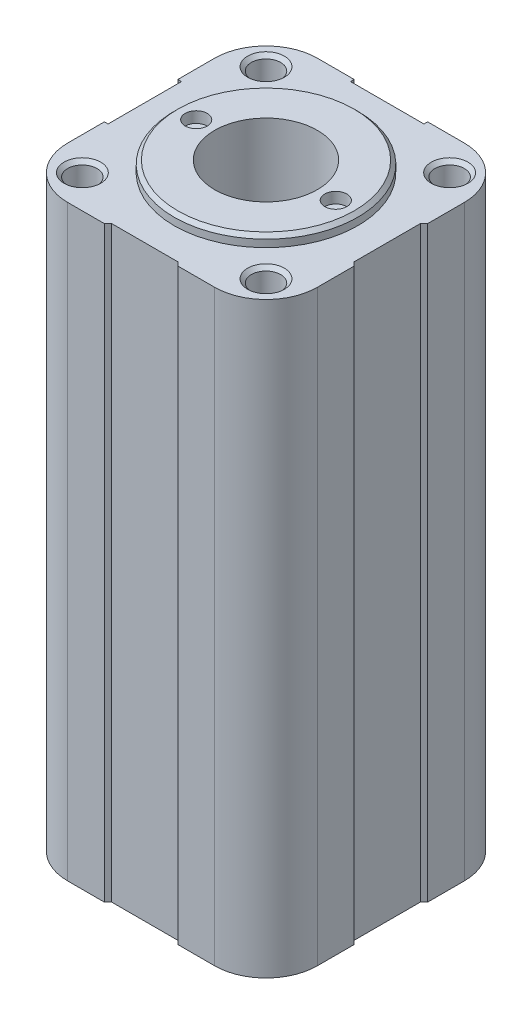
from build123d import *

# Parameters (mm, degrees)
SKETCH_1_W           = 34
SKETCH_1_H           = 34
EXTRUDE_1_DEPTH      = 80
FILLET_1_R           = 7
CUT_EXTRUDE_8_REACH  = 85.534
SKETCH_13_W          = 10
SKETCH_13_H          = 0.5
SKETCH_13_W_2        = 0.5
SKETCH_13_H_2        = 10
CHAMFER_1_SIZE       = 0.5
SKETCH_18_R          = 2
CUT_EXTRUDE_9_DEPTH  = 7.2
CHAMFER_2_SIZE       = 0.5
CUT_EXTRUDE_START    = -7.2
SKETCH_19_R          = 2
CUT_EXTRUDE_10_DEPTH = 7.2
CHAMFER_3_SIZE       = 0.5
SKETCH_20_R          = 12.5
EXTRUDE_2_DEPTH      = 1.5
CHAMFER_4_SIZE       = 0.5
SKETCH_21_R          = 7
SKETCH_21_R_2        = 1.5
CUT_EXTRUDE_11_DEPTH = 1.5
SKETCH_23_R          = 7
CUT_EXTRUDE_12_DEPTH = 13.5
CUT_EXTRUDE_START_2  = -80
SKETCH_10_W          = 10
SKETCH_10_H          = 0.5
CUT_EXTRUDE_4_DEPTH  = 80
SKETCH_12_W          = 0.5
SKETCH_12_H          = 10
CUT_EXTRUDE_5_DEPTH  = 80


with BuildPart() as part:
    # ｽｹｯﾁ1 → ﾎﾞｽ - 押し出し1 (new body)
    with BuildSketch(Plane(origin=(0, 0, 0), x_dir=(1, 0, 0), z_dir=(0, 1, 0))):
        Rectangle(SKETCH_1_W, SKETCH_1_H)
    extrude(amount=EXTRUDE_1_DEPTH)

    # ﾌｨﾚｯﾄ1
    fillet_1_edges = [part.edges().sort_by_distance(p)[0] for p in [
        (-17, 40, -17),
        (17, 40, -17),
        (17, 40, 17),
        (-17, 40, 17),
    ]]
    fillet(fillet_1_edges, radius=FILLET_1_R)

    # ｽｹｯﾁ13 → ｶｯﾄ - 押し出し8 (cut, up to next)
    with BuildSketch(Plane.XZ, mode=Mode.PRIVATE) as cut_extrude_8_sk1:
        with Locations((0, 16.75)):
            Rectangle(SKETCH_13_W, SKETCH_13_H)
    cut_extrude_8_tool1 = extrude(cut_extrude_8_sk1.sketch, amount=-CUT_EXTRUDE_8_REACH, mode=Mode.PRIVATE) & part.part
    # ｽｹｯﾁ13 → ｶｯﾄ - 押し出し8 (cut, up to next)
    with BuildSketch(Plane.XZ, mode=Mode.PRIVATE) as cut_extrude_8_sk2:
        with Locations((-16.75, 0)):
            Rectangle(SKETCH_13_W_2, SKETCH_13_H_2)
    cut_extrude_8_tool2 = extrude(cut_extrude_8_sk2.sketch, amount=-CUT_EXTRUDE_8_REACH, mode=Mode.PRIVATE) & part.part
    # ｽｹｯﾁ13 → ｶｯﾄ - 押し出し8 (cut, up to next)
    with BuildSketch(Plane.XZ, mode=Mode.PRIVATE) as cut_extrude_8_sk3:
        with Locations((0, -16.75)):
            Rectangle(SKETCH_13_W, SKETCH_13_H)
    cut_extrude_8_tool3 = extrude(cut_extrude_8_sk3.sketch, amount=-CUT_EXTRUDE_8_REACH, mode=Mode.PRIVATE) & part.part
    # ｽｹｯﾁ13 → ｶｯﾄ - 押し出し8 (cut, up to next)
    with BuildSketch(Plane.XZ, mode=Mode.PRIVATE) as cut_extrude_8_sk4:
        with Locations((16.75, 0)):
            Rectangle(SKETCH_13_W_2, SKETCH_13_H_2)
    cut_extrude_8_tool4 = extrude(cut_extrude_8_sk4.sketch, amount=-CUT_EXTRUDE_8_REACH, mode=Mode.PRIVATE) & part.part
    add(cut_extrude_8_tool1.solids().sort_by_distance((0, 0, 16.75))[0], mode=Mode.SUBTRACT)
    add(cut_extrude_8_tool2.solids().sort_by_distance((-16.75, 0, 0))[0], mode=Mode.SUBTRACT)
    add(cut_extrude_8_tool3.solids().sort_by_distance((0, 0, -16.75))[0], mode=Mode.SUBTRACT)
    add(cut_extrude_8_tool4.solids().sort_by_distance((16.75, 0, 0))[0], mode=Mode.SUBTRACT)

    # 面取り1
    chamfer_1_edges = [part.edges().sort_by_distance(p)[0] for p in [
        (-5, 40, 16.5),
        (5, 40, 16.5),
        (16.5, 40, 5),
        (16.5, 40, -5),
        (5, 40, -16.5),
        (-5, 40, -16.5),
        (-16.5, 40, -5),
        (-16.5, 40, 5),
    ]]
    chamfer(chamfer_1_edges, length=CHAMFER_1_SIZE - 0.0001)  # a hair under: the kernel refuses the full size

    # ｽｹｯﾁ18 → ｶｯﾄ - 押し出し9 (cut)
    with BuildSketch(Plane.XZ):
        with Locations(Location((12.5, -12.5, 0), (0, 0, 270))):
            Circle(SKETCH_18_R)
        with Locations(Location((-12.5, 12.5, 0), (0, 0, 270))):
            Circle(SKETCH_18_R)
    extrude(amount=-CUT_EXTRUDE_9_DEPTH, mode=Mode.SUBTRACT)

    # 面取り2
    chamfer_2_edges = [part.edges().sort_by_distance(p)[0] for p in [
        (12.5, 0, -10.5),
        (-12.5, 0, 14.5),
    ]]
    chamfer(chamfer_2_edges, length=CHAMFER_2_SIZE)

    # ｽｹｯﾁ19 → ｶｯﾄ - 押し出し10 (cut)
    with BuildSketch(Plane(origin=(0, 80, 0), x_dir=(1, 0, 0), z_dir=(0, 1, 0)).offset(CUT_EXTRUDE_START)):
        with Locations(Location((-12.5, -12.5, 0), (0, 0, 90))):
            Circle(SKETCH_19_R)
        with Locations(Location((-12.5, 12.5, 0), (0, 0, 270))):
            Circle(SKETCH_19_R)
        with Locations(Location((12.5, 12.5, 0), (0, 0, 90))):
            Circle(SKETCH_19_R)
        with Locations(Location((12.5, -12.5, 0), (0, 0, 270))):
            Circle(SKETCH_19_R)
    extrude(amount=CUT_EXTRUDE_10_DEPTH, mode=Mode.SUBTRACT)

    # 面取り3
    chamfer_3_edges = [part.edges().sort_by_distance(p)[0] for p in [
        (-12.5, 80, -14.5),
        (-12.5, 80, 14.5),
        (12.5, 80, -10.5),
        (12.5, 80, 10.5),
    ]]
    chamfer(chamfer_3_edges, length=CHAMFER_3_SIZE)

    # ｽｹｯﾁ20 → ﾎﾞｽ - 押し出し2 (add)
    with BuildSketch(Plane(origin=(0, 80, 0), x_dir=(1, 0, 0), z_dir=(0, 1, 0))):
        with Locations(Location((0, 0, 0), (0, 0, 270))):
            Circle(SKETCH_20_R)
    extrude(amount=EXTRUDE_2_DEPTH)

    # 面取り4
    chamfer_4_edges = [part.edges().sort_by_distance(p)[0] for p in [
        (0, 81.5, -12.5),
    ]]
    chamfer(chamfer_4_edges, length=CHAMFER_4_SIZE)

    # ｽｹｯﾁ21 → ｶｯﾄ - 押し出し11 (cut)
    with BuildSketch(Plane(origin=(0, 81.5, 0), x_dir=(1, 0, 0), z_dir=(0, 1, 0))):
        with Locations(Location((0, 0, 0), (0, 0, 270))):
            Circle(SKETCH_21_R)
        with Locations(Location((9.5, 0, 0), (0, 0, 270))):
            Circle(SKETCH_21_R_2)
        with Locations(Location((-9.5, 0, 0), (0, 0, 270))):
            Circle(SKETCH_21_R_2)
    extrude(amount=-CUT_EXTRUDE_11_DEPTH, mode=Mode.SUBTRACT)

    # ｽｹｯﾁ23 → ｶｯﾄ - 押し出し12 (cut)
    with BuildSketch(Plane(origin=(0, 80, 0), x_dir=(1, 0, 0), z_dir=(0, 1, 0))):
        with Locations(Location((0, 0, 0), (0, 0, 270))):
            Circle(SKETCH_23_R)
    extrude(amount=-CUT_EXTRUDE_12_DEPTH, mode=Mode.SUBTRACT)

    # ｽｹｯﾁ10 → ｶｯﾄ - 押し出し4 (cut)
    with BuildSketch(Plane.XZ.offset(CUT_EXTRUDE_START_2)):
        with Locations((0, -16.75)):
            Rectangle(SKETCH_10_W, SKETCH_10_H)
    extrude(amount=CUT_EXTRUDE_4_DEPTH, mode=Mode.SUBTRACT)

    # ｽｹｯﾁ12 → ｶｯﾄ - 押し出し5 (cut)
    with BuildSketch(Plane.XZ.offset(CUT_EXTRUDE_START_2)):
        with Locations((-16.75, 0)):
            Rectangle(SKETCH_12_W, SKETCH_12_H)
    extrude(amount=CUT_EXTRUDE_5_DEPTH, mode=Mode.SUBTRACT)


solid = part.part
